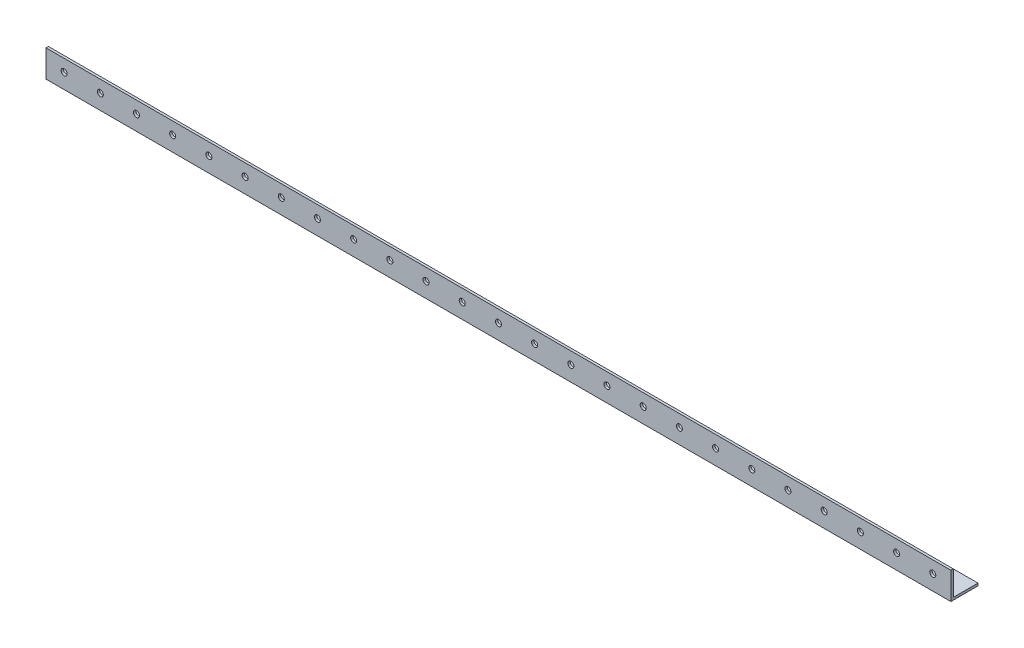
from build123d import *

# Parameters (mm, degrees)
EXTRUDE_1_DEPTH     = 1500
SKETCH_2_R          = 5
CUT_EXTRUDE_1_DEPTH = 1502.349393046
SKETCH_3_R          = 5
CUT_EXTRUDE_2_DEPTH = 1502.349393046


with BuildPart() as part:
    # Эскиз1 → Вытянуть-Тонкостенный1 (new body)
    with BuildSketch(Plane(origin=(0, 0, 0), x_dir=(0, 0, -1), z_dir=(1, 0, 0))):
        Polygon((45, 0), (0, 0), (0, 45), (4, 45), (4, 4), (45, 4), align=None)
    extrude(amount=EXTRUDE_1_DEPTH)

    # Эскиз2 → Вырез-Вытянуть1 (cut, through all)
    with BuildSketch(Plane.XY):
        with Locations((30, 25)):
            Circle(SKETCH_2_R)
        with Locations((90, 25)):
            Circle(SKETCH_2_R)
        with Locations((150, 25)):
            Circle(SKETCH_2_R)
        with Locations((210, 25)):
            Circle(SKETCH_2_R)
        with Locations((270, 25)):
            Circle(SKETCH_2_R)
        with Locations((330, 25)):
            Circle(SKETCH_2_R)
        with Locations((390, 25)):
            Circle(SKETCH_2_R)
        with Locations((450, 25)):
            Circle(SKETCH_2_R)
        with Locations((510, 25)):
            Circle(SKETCH_2_R)
        with Locations((570, 25)):
            Circle(SKETCH_2_R)
        with Locations((630, 25)):
            Circle(SKETCH_2_R)
        with Locations((690, 25)):
            Circle(SKETCH_2_R)
        with Locations((750, 25)):
            Circle(SKETCH_2_R)
        with Locations((810, 25)):
            Circle(SKETCH_2_R)
        with Locations((870, 25)):
            Circle(SKETCH_2_R)
        with Locations((930, 25)):
            Circle(SKETCH_2_R)
        with Locations((990, 25)):
            Circle(SKETCH_2_R)
        with Locations((1050, 25)):
            Circle(SKETCH_2_R)
        with Locations((1110, 25)):
            Circle(SKETCH_2_R)
        with Locations((1170, 25)):
            Circle(SKETCH_2_R)
        with Locations((1230, 25)):
            Circle(SKETCH_2_R)
        with Locations((1290, 25)):
            Circle(SKETCH_2_R)
        with Locations((1350, 25)):
            Circle(SKETCH_2_R)
        with Locations((1410, 25)):
            Circle(SKETCH_2_R)
        with Locations((1470, 25)):
            Circle(SKETCH_2_R)
    extrude(amount=-CUT_EXTRUDE_1_DEPTH, mode=Mode.SUBTRACT)

    # Эскиз3 → Вырез-Вытянуть2 (cut, through all)
    with BuildSketch(Plane.XZ):
        with Locations((30, -25)):
            Circle(SKETCH_3_R)
        with Locations((90, -25)):
            Circle(SKETCH_3_R)
        with Locations((150, -25)):
            Circle(SKETCH_3_R)
        with Locations((210, -25)):
            Circle(SKETCH_3_R)
        with Locations((270, -25)):
            Circle(SKETCH_3_R)
        with Locations((330, -25)):
            Circle(SKETCH_3_R)
        with Locations((390, -25)):
            Circle(SKETCH_3_R)
        with Locations((450, -25)):
            Circle(SKETCH_3_R)
        with Locations((510, -25)):
            Circle(SKETCH_3_R)
        with Locations((570, -25)):
            Circle(SKETCH_3_R)
        with Locations((630, -25)):
            Circle(SKETCH_3_R)
        with Locations((690, -25)):
            Circle(SKETCH_3_R)
        with Locations((750, -25)):
            Circle(SKETCH_3_R)
        with Locations((810, -25)):
            Circle(SKETCH_3_R)
        with Locations((870, -25)):
            Circle(SKETCH_3_R)
        with Locations((930, -25)):
            Circle(SKETCH_3_R)
        with Locations((990, -25)):
            Circle(SKETCH_3_R)
        with Locations((1050, -25)):
            Circle(SKETCH_3_R)
        with Locations((1110, -25)):
            Circle(SKETCH_3_R)
        with Locations((1170, -25)):
            Circle(SKETCH_3_R)
        with Locations((1230, -25)):
            Circle(SKETCH_3_R)
        with Locations((1290, -25)):
            Circle(SKETCH_3_R)
        with Locations((1350, -25)):
            Circle(SKETCH_3_R)
        with Locations((1410, -25)):
            Circle(SKETCH_3_R)
        with Locations((1470, -25)):
            Circle(SKETCH_3_R)
    extrude(amount=-CUT_EXTRUDE_2_DEPTH, mode=Mode.SUBTRACT)


solid = part.part
